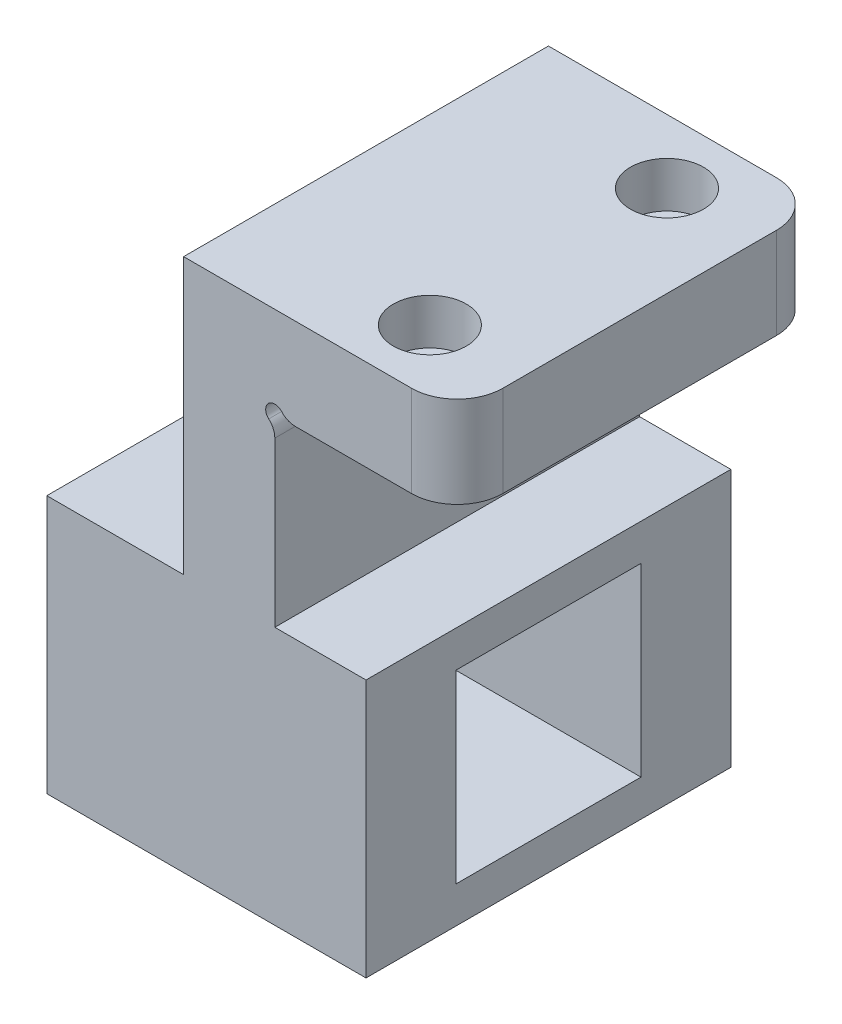
from build123d import *

# Parameters (mm, degrees)
DODANIE_WYCI_GNI_CIE1_DEPTH = 40
SZKIC7_R                    = 4
WYTNIJ_WYCI_GNI_CIE2_DEPTH  = 5
SZKIC8_R                    = 2.1
WYTNIJ_WYCI_GNI_CIE3_DEPTH  = 5
SZKIC9_R                    = 4
WYTNIJ_WYCI_GNI_CIE4_DEPTH  = 5
SZKIC10_R                   = 2.1
WYTNIJ_WYCI_GNI_CIE5_DEPTH  = 5
ZAOKR_GLENIE1_R             = 5
BOSS_EXTRUDE1_DEPTH         = 15
BOSS_EXTRUDE1_DEPTH_BACK    = 20.0001
SKETCH1_W                   = 40
SKETCH1_H                   = 28.3
SKETCH1_W_2                 = 20.3
SKETCH1_H_2                 = 20.3


with BuildPart() as part:
    # Szkic1 → Dodanie-wyciągnięcie1 (new body)
    with BuildSketch(Plane.XY):
        with BuildLine():
            Line((0, 0), (0, 19.763932023))
            ThreePointArc((0, 19.763932023), (-0.174258142, 20.580428603), (-0.666666667, 21.254644008))
            ThreePointArc((-0.666666667, 21.254644008), (-0.707106781, 22.707106781), (0.745355992, 22.666666667))
            ThreePointArc((0.745355992, 22.666666667), (1.419571397, 22.174258142), (2.236067977, 22))
            Line((2.236067977, 22), (20, 22))
            Line((20, 22), (20, 32))
            Line((20, 32), (-10, 32))
            Line((-10, 32), (-10, 0))
            Line((-10, 0), (0, 0))
        make_face()
    extrude(amount=DODANIE_WYCI_GNI_CIE1_DEPTH)

    # Szkic7 → Wytnij-wyciągnięcie2 (cut)
    with BuildSketch(Plane.ZY.offset(10)):
        with Locations((20, 10)):
            Circle(SZKIC7_R)
    extrude(amount=-WYTNIJ_WYCI_GNI_CIE2_DEPTH, mode=Mode.SUBTRACT)

    # Szkic8 → Wytnij-wyciągnięcie3 (cut)
    with BuildSketch(Plane.ZY.offset(5)):
        with Locations((20, 10)):
            Circle(SZKIC8_R)
    extrude(amount=-WYTNIJ_WYCI_GNI_CIE3_DEPTH, mode=Mode.SUBTRACT)

    # Szkic9 → Wytnij-wyciągnięcie4 (cut)
    with BuildSketch(Plane(origin=(0, 32, 0), x_dir=(1, 0, 0), z_dir=(0, 1, 0))):
        with Locations((10, -7)):
            Circle(SZKIC9_R)
        with Locations((10, -33)):
            Circle(SZKIC9_R)
    extrude(amount=-WYTNIJ_WYCI_GNI_CIE4_DEPTH, mode=Mode.SUBTRACT)

    # Szkic10 → Wytnij-wyciągnięcie5 (cut)
    with BuildSketch(Plane(origin=(0, 27, 0), x_dir=(1, 0, 0), z_dir=(0, 1, 0))):
        with Locations((10, -7)):
            Circle(SZKIC10_R)
        with Locations((10, -33)):
            Circle(SZKIC10_R)
    extrude(amount=-WYTNIJ_WYCI_GNI_CIE5_DEPTH, mode=Mode.SUBTRACT)

    # Zaokrąglenie1
    zaokr_glenie1_edges = [part.edges().sort_by_distance(p)[0] for p in [
        (20, 27, 0),
        (20, 27, 40),
    ]]
    fillet(zaokr_glenie1_edges, radius=ZAOKR_GLENIE1_R)

    # Sketch1 → Boss-Extrude1 (add, two sides: drawn at the far end of the back side and taken through both)
    with BuildSketch(Plane.ZY.offset(10).offset(-BOSS_EXTRUDE1_DEPTH_BACK)):
        with Locations((20, -12.35)):
            Rectangle(SKETCH1_W, SKETCH1_H)
        with Locations((20, -12.35)):
            Rectangle(SKETCH1_W_2, SKETCH1_H_2, mode=Mode.SUBTRACT)
    extrude(amount=BOSS_EXTRUDE1_DEPTH + BOSS_EXTRUDE1_DEPTH_BACK)


solid = part.part
